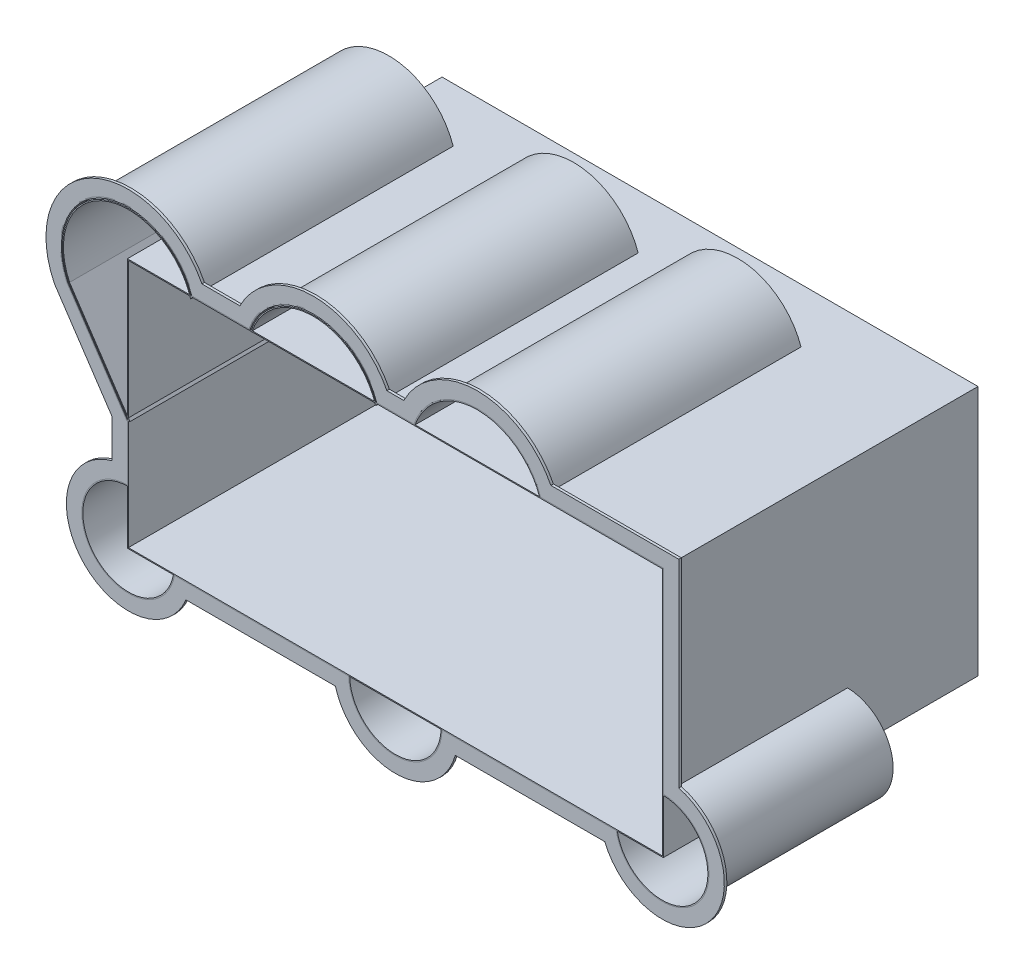
from build123d import *

# Parameters (mm, degrees)
BOSS_EXTRUDE2_DEPTH         = 25
SKETCH13_W                  = 5280
SKETCH13_H                  = 2470
SKETCH13_W_2                = 5260
SKETCH13_H_2                = 2450
EXTRUDE_THIN3_DEPTH         = 3100
OLTC_ROUND_EXTRUDE5_DEPTH   = 1815
OLTC_ROUND_EXTRUDE5_2_DEPTH = 1815
OLTC_ROUND_EXTRUDE5_3_DEPTH = 1815
EXTRUDE_THIN6_DEPTH         = 2565
EXTRUDE_THIN6_2_DEPTH       = 2565
EXTRUDE_THIN6_3_DEPTH       = 2565


with BuildPart() as part:
    # curb → Boss-Extrude2 (new body)
    with BuildSketch(Plane.XY):
        with BuildLine():
            ThreePointArc((-1905.669274433, 1527), (-2992.100860231, 1886.792244744), (-3359.22062819, 802.81478835))
            Line((-3359.22062819, 802.81478835), (-2792, -45.527139379))
            Line((-2792, -45.527139379), (-2792, -424.105941715))
            ThreePointArc((-2792, -424.105941715), (-3087.118903787, -1419.796833395), (-2063.089229648, -1247))
            Line((-2063.089229648, -1247), (-590.169467187, -1247))
            ThreePointArc((-590.169467187, -1247), (0, -1697), (590.169467187, -1247))
            Line((590.169467187, -1247), (2063.089229648, -1247))
            ThreePointArc((2063.089229648, -1247), (3087.118903787, -1419.796833395), (2792, -424.105941715))
            Line((2792, -424.105941715), (2792, 1527))
            Line((2792, 1527), (1531.830725567, 1527))
            ThreePointArc((1531.830725567, 1527), (807.5, 1972), (83.169274433, 1527))
            Line((83.169274433, 1527), (-83.169274433, 1527))
            ThreePointArc((-83.169274433, 1527), (-807.5, 1972), (-1531.830725567, 1527))
            Line((-1531.830725567, 1527), (-1905.669274433, 1527))
        make_face()
        with BuildLine():
            Line((-2640, -554.131540547), (-2640, 0.607028525))
            Line((-2640, 0.607028525), (-3226.904268523, 878.38804319))
            ThreePointArc((-3226.904268523, 878.38804319), (-2878.675275655, 1771.359638247), (-2006.000801283, 1375))
            Line((-2006.000801283, 1375), (-1431.499198717, 1375))
            ThreePointArc((-1431.499198717, 1375), (-807.5, 1820), (-183.500801283, 1375))
            Line((-183.500801283, 1375), (183.500801283, 1375))
            ThreePointArc((183.500801283, 1375), (807.5, 1820), (1431.499198717, 1375))
            Line((1431.499198717, 1375), (2640, 1375))
            Line((2640, 1375), (2640, -554.131540547))
            ThreePointArc((2640, -554.131540547), (2978.190785718, -1313.44247389), (2176.187676846, -1095))
            Line((2176.187676846, -1095), (459.891291503, -1095))
            ThreePointArc((459.891291503, -1095), (0, -1545), (-459.891291503, -1095))
            Line((-459.891291503, -1095), (-2176.187676846, -1095))
            ThreePointArc((-2176.187676846, -1095), (-2978.190785718, -1313.44247389), (-2640, -554.131540547))
        make_face(mode=Mode.SUBTRACT)
    extrude(amount=-BOSS_EXTRUDE2_DEPTH)


with BuildPart() as body_2:
    # Sketch13 → Extrude-Thin3 (new body)
    with BuildSketch(Plane.XY):
        with Locations((0, 140)):
            Rectangle(SKETCH13_W, SKETCH13_H)
        with Locations((0, 140)):
            Rectangle(SKETCH13_W_2, SKETCH13_H_2, mode=Mode.SUBTRACT)
    extrude(amount=-EXTRUDE_THIN3_DEPTH)


with BuildPart() as body_3:
    # hv round → oltc round-Extrude5 (new body)
    with BuildSketch(Plane.XY):
        with BuildLine():
            Line((2184.636410132, -1085), (2176.187676846, -1095))
            ThreePointArc((2176.187676846, -1095), (2978.190785718, -1313.44247389), (2640, -554.131540547))
            Line((2640, -554.131540547), (2630, -564.001111112))
            ThreePointArc((2630, -564.001111112), (2971.056689396, -1306.399078725), (2184.636410132, -1085))
        make_face()
    extrude(amount=-OLTC_ROUND_EXTRUDE5_DEPTH)


with BuildPart() as body_4:
    # hv round → oltc round-Extrude5 2 (new body)
    with BuildSketch(Plane.XY):
        with BuildLine():
            Line((459.891291503, -1095), (450, -1085))
            ThreePointArc((450, -1085), (0, -1535), (-450, -1085))
            Line((-450, -1085), (-459.891291503, -1095))
            ThreePointArc((-459.891291503, -1095), (0, -1545), (459.891291503, -1095))
        make_face()
    extrude(amount=-OLTC_ROUND_EXTRUDE5_2_DEPTH)


with BuildPart() as body_5:
    # hv round → oltc round-Extrude5 3 (new body)
    with BuildSketch(Plane.XY):
        with BuildLine():
            Line((-2176.187676846, -1095), (-2184.636410132, -1085))
            ThreePointArc((-2184.636410132, -1085), (-2971.056689396, -1306.399078725), (-2630, -564.001111112))
            Line((-2630, -564.001111112), (-2640, -554.131540547))
            ThreePointArc((-2640, -554.131540547), (-2978.190785718, -1313.44247389), (-2176.187676846, -1095))
        make_face()
    extrude(amount=-OLTC_ROUND_EXTRUDE5_3_DEPTH)


with BuildPart() as body_6:
    # oltc round → Extrude-Thin6 (new body)
    with BuildSketch(Plane.XY):
        with BuildLine():
            Line((-1994.876995624, 1373.351281489), (-2016.699304896, 1342.926918153))
            ThreePointArc((-2016.699304896, 1342.926918153), (-2857.963856524, 1758.023812334), (-3209.444791338, 888.257964622))
            Line((-3209.444791338, 888.257964622), (-2614.19136966, -2.010142948))
            Line((-2614.19136966, -2.010142948), (-2644.19136966, -11.115570824))
            Line((-2644.19136966, -11.115570824), (-3235.62924464, 873.445959658))
            ThreePointArc((-3235.62924464, 873.445959658), (-2880.387306316, 1781.4549033), (-1994.876995624, 1373.351281489))
        make_face()
        with BuildLine():
            Line((-2006.000801283, 1375), (-2013.173444151, 1365))
            ThreePointArc((-2013.173444151, 1365), (-2871.262954199, 1763.566224147), (-3218.17614189, 883.325414771))
            Line((-3218.17614189, 883.325414771), (-2630, 3.64217115))
            Line((-2630, 3.64217115), (-2640, 0.607028525))
            Line((-2640, 0.607028525), (-3226.904268523, 878.38804319))
            ThreePointArc((-3226.904268523, 878.38804319), (-2878.675275655, 1771.359638247), (-2006.000801283, 1375))
        make_face(mode=Mode.SUBTRACT)
    extrude(amount=-EXTRUDE_THIN6_DEPTH)


with BuildPart() as body_7:
    # oltc round → Extrude-Thin6 2 (new body)
    with BuildSketch(Plane.XY):
        with BuildLine():
            ThreePointArc((-1424.326555849, 1365), (-807.5, 1810), (-190.673444151, 1365))
            Line((-190.673444151, 1365), (-183.500801283, 1375))
            ThreePointArc((-183.500801283, 1375), (-807.5, 1820), (-1431.499198717, 1375))
            Line((-1431.499198717, 1375), (-1440.953732031, 1378.257575758))
            ThreePointArc((-1440.953732031, 1378.257575758), (-804.908755433, 1829.994989124), (-172.376995624, 1373.351281489))
            Line((-172.376995624, 1373.351281489), (-194.199304896, 1342.926918153))
            ThreePointArc((-194.199304896, 1342.926918153), (-797.581530686, 1799.923139108), (-1414.836916528, 1361.846153846))
            Line((-1414.836916528, 1361.846153846), (-1424.326555849, 1365))
        make_face()
    extrude(amount=-EXTRUDE_THIN6_2_DEPTH)


with BuildPart() as body_8:
    # oltc round → Extrude-Thin6 3 (new body)
    with BuildSketch(Plane.XY):
        with BuildLine():
            ThreePointArc((1424.326555849, 1365), (807.5, 1810), (190.673444151, 1365))
            Line((190.673444151, 1365), (181.183804831, 1368.153846154))
            ThreePointArc((181.183804831, 1368.153846154), (807.5, 1820), (1433.816195169, 1368.153846154))
            Line((1433.816195169, 1368.153846154), (1424.326555849, 1365))
        make_face()
    extrude(amount=-EXTRUDE_THIN6_3_DEPTH)


solid = Compound([part.part, body_2.part, body_3.part, body_4.part, body_5.part, body_6.part, body_7.part, body_8.part])
